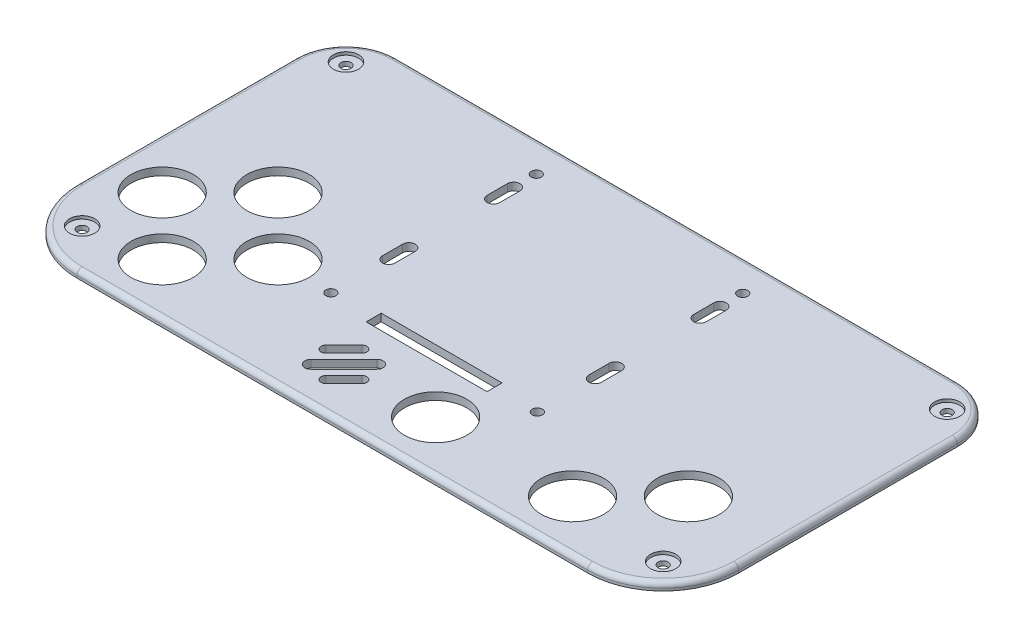
from build123d import *

# Parameters (mm, degrees)
ESBO_O1_W                          = 131.4
ESBO_O1_H                          = 68.4
BASE_DEPTH                         = 1.5
FILETE1_R                          = 10
FILETE2_R                          = 10
FILETE3_R                          = 15
FILETE4_R                          = 15
ESBO_O2_R                          = 6.2
FURO_DOS_BOT_ES_DEPTH              = 75.083601424
DISPLAY_START                      = -1.5
DISPLAY_OUTLINE_W                  = 24
DISPLAY_OUTLINE_H                  = 3
DISPLAY_DEPTH                      = 1.5
FILETE5_R                          = 1
FURO_BUZZER_DEPTH                  = 75.083601424
ESBO_O5_R                          = 1
FURO_DOS_PARAFUSOS_DEPTH           = 75.083601424
ESBO_O6_R                          = 2.5
FURO_DA_CABE_A_DOS_PARAFUSOS_DEPTH = 0.6
ESBO_O7_R                          = 1
FURO_ADICIONAIS_DO_DISPLAY_DEPTH   = 10


# Read off the part's stored shape, not the designer's step: Display
with BuildPart() as part:
    # Esboço1 → Base (new body)
    with BuildSketch(Plane(origin=(0, 0, 0), x_dir=(1, 0, 0), z_dir=(0, 1, 0))):
        Rectangle(ESBO_O1_W, ESBO_O1_H)
    extrude(amount=BASE_DEPTH)

    # Filete1
    filete1_edges = [part.edges().sort_by_distance(p)[0] for p in [
        (65.7, 0.75, -34.2),
    ]]
    fillet(filete1_edges, radius=FILETE1_R)

    # Filete2
    filete2_edges = [part.edges().sort_by_distance(p)[0] for p in [
        (-65.7, 0.75, -34.2),
    ]]
    fillet(filete2_edges, radius=FILETE2_R)

    # Filete3
    filete3_edges = [part.edges().sort_by_distance(p)[0] for p in [
        (-65.7, 0.75, 34.2),
    ]]
    fillet(filete3_edges, radius=FILETE3_R)

    # Filete4
    filete4_edges = [part.edges().sort_by_distance(p)[0] for p in [
        (65.7, 0.75, 34.2),
    ]]
    fillet(filete4_edges, radius=FILETE4_R)

    # Esboço2 → Furo dos botões (cut, through all)
    with BuildSketch(Plane(origin=(0, 1.5, 0), x_dir=(1, 0, 0), z_dir=(0, 1, 0))):
        with Locations(Location((-44, -1, 0), (0, 0, 270))):
            Circle(ESBO_O2_R)
        with Locations(Location((-32.5, -12.5, 0), (0, 0, 270))):
            Circle(ESBO_O2_R)
        with Locations(Location((-55.5, -12.5, 0), (0, 0, 270))):
            Circle(ESBO_O2_R)
        with Locations(Location((-44, -24, 0), (0, 0, 270))):
            Circle(ESBO_O2_R)
        with Locations(Location((37.5, -24, 0), (0, 0, 270))):
            Circle(ESBO_O2_R)
        with Locations(Location((49, -12.5, 0), (0, 0, 270))):
            Circle(ESBO_O2_R)
        with Locations(Location((10.3, -24, 0), (0, 0, 270))):
            Circle(ESBO_O2_R)
    extrude(amount=-FURO_DOS_BOT_ES_DEPTH, mode=Mode.SUBTRACT)

    # Display outline → Display (cut)
    with BuildSketch(Plane(origin=(0, 1.5, 0), x_dir=(1, 0, 0), z_dir=(0, 1, 0)).offset(DISPLAY_START)):
        with Locations((-1, -13)):
            Rectangle(DISPLAY_OUTLINE_W, DISPLAY_OUTLINE_H)
    extrude(amount=DISPLAY_DEPTH, mode=Mode.SUBTRACT)

    # Filete5
    filete5_edges = [part.edges().sort_by_distance(p)[0] for p in [
        (0, 1.5, -34.2),
        (62.771067812, 1.5, -31.271067812),
        (-65.7, 1.5, -2.5),
        (-62.771067812, 1.5, -31.271067812),
        (0, 1.5, 34.2),
        (-61.306601718, 1.5, 29.806601718),
        (65.7, 1.5, -2.5),
        (61.306601718, 1.5, 29.806601718),
    ]]
    fillet(filete5_edges, radius=FILETE5_R)

    # Esboço4 → Furo buzzer (cut, through all)
    with BuildSketch(Plane(origin=(0, 1.5, 0), x_dir=(1, 0, 0), z_dir=(0, 1, 0))):
        with BuildLine():
            Line((-11.223401872, -20.676598128), (-9.809188309, -22.090811691))
            Line((-9.809188309, -22.090811691), (-8.041421356, -20.323044738))
            ThreePointArc((-8.041421356, -20.323044738), (-8.041421356, -18.908831175), (-9.455634919, -18.908831175))
            Line((-9.455634919, -18.908831175), (-11.223401872, -20.676598128))
        make_face()
        with BuildLine():
            Line((-11.576955262, -23.858578644), (-9.809188309, -22.090811691))
            Line((-9.809188309, -22.090811691), (-11.223401872, -20.676598128))
            Line((-11.223401872, -20.676598128), (-12.991168825, -22.444365081))
            ThreePointArc((-12.991168825, -22.444365081), (-12.991168825, -23.858578644), (-11.576955262, -23.858578644))
        make_face()
        with BuildLine():
            Line((-5.460481605, -19.86342533), (-8.748528137, -23.151471863))
            Line((-8.748528137, -23.151471863), (-7.051471863, -24.848528137))
            Line((-7.051471863, -24.848528137), (-3.76342533, -21.560481605))
            ThreePointArc((-3.76342533, -21.560481605), (-3.76342533, -19.86342533), (-5.460481605, -19.86342533))
        make_face()
        with BuildLine():
            Line((-8.748528137, -23.151471863), (-12.03657467, -26.439518395))
            ThreePointArc((-12.03657467, -26.439518395), (-12.03657467, -28.13657467), (-10.339518395, -28.13657467))
            Line((-10.339518395, -28.13657467), (-7.051471863, -24.848528137))
            Line((-7.051471863, -24.848528137), (-8.748528137, -23.151471863))
        make_face()
        with BuildLine():
            Line((-4.576598128, -27.323401872), (-5.990811691, -25.909188309))
            Line((-5.990811691, -25.909188309), (-7.758578644, -27.676955262))
            ThreePointArc((-7.758578644, -27.676955262), (-7.758578644, -29.091168825), (-6.344365081, -29.091168825))
            Line((-6.344365081, -29.091168825), (-4.576598128, -27.323401872))
        make_face()
        with BuildLine():
            Line((-4.223044738, -24.141421356), (-5.990811691, -25.909188309))
            Line((-5.990811691, -25.909188309), (-4.576598128, -27.323401872))
            Line((-4.576598128, -27.323401872), (-2.808831175, -25.555634919))
            ThreePointArc((-2.808831175, -25.555634919), (-2.808831175, -24.141421356), (-4.223044738, -24.141421356))
        make_face()
    extrude(amount=-FURO_BUZZER_DEPTH, mode=Mode.SUBTRACT)

    # Esboço5 → Furo dos parafusos (cut, through all)
    with BuildSketch(Plane(origin=(0, 1.5, 0), x_dir=(1, 0, 0), z_dir=(0, 1, 0))):
        with Locations(Location((59.7, 28.2, 0), (0, 0, 270))):
            Circle(ESBO_O5_R)
        with Locations(Location((57.7, -26.2, 0), (0, 0, 270))):
            Circle(ESBO_O5_R)
        with Locations(Location((-57.7, -26.2, 0), (0, 0, 270))):
            Circle(ESBO_O5_R)
        with Locations(Location((-59.7, 28.2, 0), (0, 0, 270))):
            Circle(ESBO_O5_R)
    extrude(amount=-FURO_DOS_PARAFUSOS_DEPTH, mode=Mode.SUBTRACT)

    # Esboço6 → Furo da cabeça dos parafusos (cut)
    with BuildSketch(Plane(origin=(0, 1.5, 0), x_dir=(1, 0, 0), z_dir=(0, 1, 0))):
        with Locations(Location((-59.7, 28.2, 0), (0, 0, 270))):
            Circle(ESBO_O6_R)
        with Locations(Location((59.7, 28.2, 0), (0, 0, 270))):
            Circle(ESBO_O6_R)
        with Locations(Location((57.7, -26.2, 0), (0, 0, 270))):
            Circle(ESBO_O6_R)
        with Locations(Location((-57.7, -26.2, 0), (0, 0, 270))):
            Circle(ESBO_O6_R)
    extrude(amount=-FURO_DA_CABE_A_DOS_PARAFUSOS_DEPTH, mode=Mode.SUBTRACT)

    # Esboço7 → Furo adicionais do display (cut)
    with BuildSketch(Plane(origin=(0, 1.5, 0), x_dir=(1, 0, 0), z_dir=(0, 1, 0))):
        with Locations(Location((-21.5, -13, 0), (0, 0, 270))):
            Circle(ESBO_O7_R)
        with Locations(Location((19.5, -13, 0), (0, 0, 270))):
            Circle(ESBO_O7_R)
        with Locations(Location((-21.5, 27.8, 0), (0, 0, 270))):
            Circle(ESBO_O7_R)
        with Locations(Location((19.5, 27.8, 0), (0, 0, 270))):
            Circle(ESBO_O7_R)
        with BuildLine():
            Line((-22.75, -1.5), (-22.75, 2.5))
            ThreePointArc((-22.75, 2.5), (-21.5, 3.75), (-20.25, 2.5))
            Line((-20.25, 2.5), (-20.25, -1.5))
            ThreePointArc((-20.25, -1.5), (-21.5, -2.75), (-22.75, -1.5))
        make_face()
        with BuildLine():
            Line((-22.75, 19.3), (-22.75, 23.3))
            ThreePointArc((-22.75, 23.3), (-21.5, 24.55), (-20.25, 23.3))
            Line((-20.25, 23.3), (-20.25, 19.3))
            ThreePointArc((-20.25, 19.3), (-21.5, 18.05), (-22.75, 19.3))
        make_face()
        with BuildLine():
            Line((18.25, 19.3), (18.25, 23.3))
            ThreePointArc((18.25, 23.3), (19.5, 24.55), (20.75, 23.3))
            Line((20.75, 23.3), (20.75, 19.3))
            ThreePointArc((20.75, 19.3), (19.5, 18.05), (18.25, 19.3))
        make_face()
        with BuildLine():
            Line((18.25, -1.5), (18.25, 2.5))
            ThreePointArc((18.25, 2.5), (19.5, 3.75), (20.75, 2.5))
            Line((20.75, 2.5), (20.75, -1.5))
            ThreePointArc((20.75, -1.5), (19.5, -2.75), (18.25, -1.5))
        make_face()
    extrude(amount=-FURO_ADICIONAIS_DO_DISPLAY_DEPTH, mode=Mode.SUBTRACT)


solid = part.part
